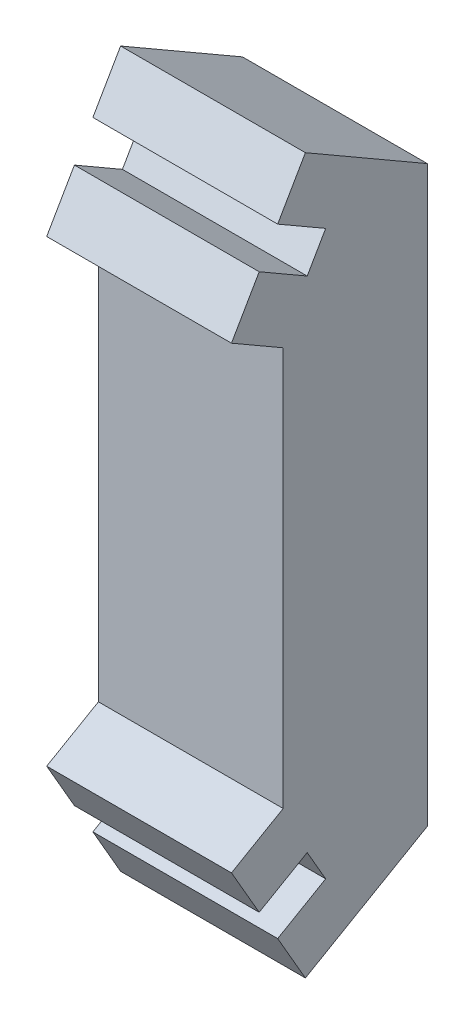
from build123d import *

# Parameters (mm, degrees)
EXTRUDE_1_DEPTH = 10


with BuildPart() as part:
    # Эскиз1 → Бобышка-Вытянуть1 (new body)
    with BuildSketch(Plane(origin=(0, 0, 0), x_dir=(0, 0, -1), z_dir=(1, 0, 0))):
        Polygon((-2.039845048, 21.476884737), (-4.637921259, 22.976884737), (-6.137921259, 20.378808526), (-3.338883154, 18.762783122), (-3.338883154, -2.829013647), (-6.137921259, -4.445039051), (-4.637921259, -7.043115263), (-2.039845048, -5.543115263), (-1.039845048, -7.27516607), (-2.338883154, -8.02516607), (-3.637921259, -8.77516607), (-2.137921259, -11.373242281), (4.460154952, -7.563841205), (4.460154952, 23.49761068), (-2.137921259, 27.307011756), (-3.637921259, 24.708935545), (-2.338883154, 23.958935545), (-1.039845048, 23.208935545), align=None)
    extrude(amount=EXTRUDE_1_DEPTH)


solid = part.part
